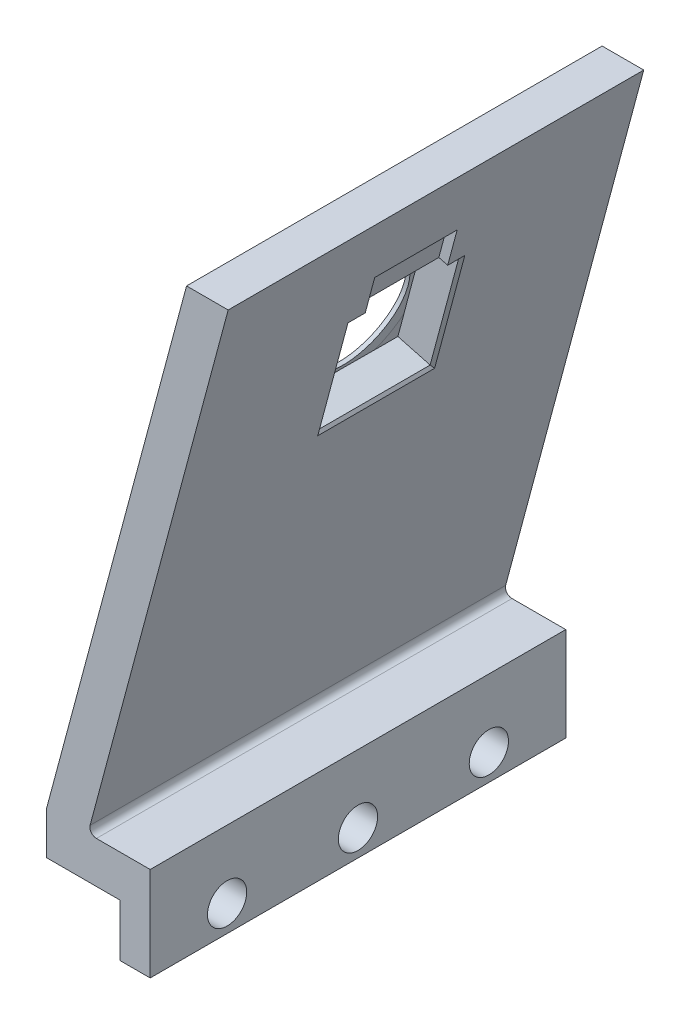
from build123d import *

# Parameters (mm, degrees)
ESQUISSE1_W             = 2.296627968
ESQUISSE1_H             = 4
BOSS_EXTRU_1_DEPTH      = 31.75
ESQUISSE2_W             = 8.53
ESQUISSE2_H             = 8.53
ENL_V_MAT_EXTRU_1_DEPTH = 2.75
ESQUISSE3_R             = 3.98
ENL_V_MAT_EXTRU_2_DEPTH = 31.75
CHANFREIN3_SIZE         = 0.01605866
CHANFREIN3_SIZE_2       = 0.92
ESQUISSE5_W             = 6.3
ESQUISSE5_H             = 3
ENL_V_MAT_EXTRU_3_DEPTH = 0.7
CHANFREIN4_SIZE         = 0.2
ESQUISSE6_R             = 1.5
ENL_V_MAT_EXTRU_4_DEPTH = 14.7
CONG_3_R                = 0.5


with BuildPart() as part:
    # Esquisse1 → Boss.-Extru.1 (new body)
    with BuildSketch(Plane.XY):
        Polygon((3.18, 0), (0, 0), (10.717967697, 40), (13.897967697, 40), align=None)
        Polygon((3.18, 0), (0, 0), (0, -3.18), (5.643372032, -3.18), (7.94, -3.18), (7.94, 0), align=None)
        with Locations((6.791686016, -5.18)):
            Rectangle(ESQUISSE1_W, ESQUISSE1_H)
    extrude(amount=BOSS_EXTRU_1_DEPTH)

    # Esquisse2 → Enlèv. mat.-Extru.1 (cut)
    with BuildSketch(Plane(origin=(2.966980392, -0.795, 0), x_dir=(0, 0, -1), z_dir=(0.9659258262890674, -0.2588190451025244, 0))):
        with Locations((-16.145, 30.088044563)):
            Rectangle(ESQUISSE2_W, ESQUISSE2_H)
    extrude(amount=-ENL_V_MAT_EXTRU_1_DEPTH, mode=Mode.SUBTRACT)

    # Esquisse3 → Enlèv. mat.-Extru.2 (cut)
    with BuildSketch(Plane(origin=(0.31068437, -0.083247626, 0), x_dir=(0, 0, -1), z_dir=(0.9659258262890674, -0.2588190451025245, 0))):
        with Locations(Location((-16.145, 30.055023218, 0), (0, 0, 90))):
            Circle(ESQUISSE3_R)
    extrude(amount=-ENL_V_MAT_EXTRU_2_DEPTH, mode=Mode.SUBTRACT)

    # Chanfrein3
    # the kernel refuses this chamfer: 0.92, 0.01605866 mm, written as the material it takes off along each edge
    with BuildSketch(Plane(origin=(8.08949678, 28.94767551, 16.145), x_dir=(0.2588190451025241, 0.9659258262890673, 0), z_dir=(0, 0, -1))) as chanfrein3_piece_1_section:
        Polygon((3.98, -CHANFREIN3_SIZE * 0.999999983433), (3.98 + CHANFREIN3_SIZE_2, 0), (3.98, 0), align=None)
    chanfrein3_piece_1 = revolve(axis=Axis((8.08949678, 28.94767551, 16.145), (0.9659258262890674, -0.2588190451025245, 0)), mode=Mode.PRIVATE)
    chanfrein3_piece_1 = split(chanfrein3_piece_1, bisect_by=Plane(origin=(9.196219069, 33.100769288, 19.703208658), z_dir=(-0.25881904510252435, -0.9659258262890673, 0)), keep=Keep.TOP, mode=Mode.PRIVATE)
    chanfrein3_piece_1 = split(chanfrein3_piece_1, bisect_by=Plane(origin=(8.615509723, 30.933532505, 20.41), z_dir=(0, 0, -1)), keep=Keep.TOP, mode=Mode.PRIVATE)
    chanfrein3_piece_1 = split(chanfrein3_piece_1, bisect_by=Plane(origin=(8.615509723, 30.933532505, 11.88), z_dir=(0, 0, 1)), keep=Keep.TOP, mode=Mode.PRIVATE)
    chanfrein3_piece_1 = split(chanfrein3_piece_1, bisect_by=Plane(origin=(6.988492614, 24.86142199, 19.703208658), z_dir=(0.25881904510252435, 0.9659258262890673, 0)), keep=Keep.TOP, mode=Mode.PRIVATE)
    add(chanfrein3_piece_1, mode=Mode.SUBTRACT)

    # Esquisse5 → Enlèv. mat.-Extru.3 (cut)
    with BuildSketch(Plane(origin=(2.966980392, -0.795, 0), x_dir=(0, 0, -1), z_dir=(0.9659258262890674, -0.2588190451025244, 0))):
        with Locations((-16.14, 35.853044563)):
            Rectangle(ESQUISSE5_W, ESQUISSE5_H)
    extrude(amount=-ENL_V_MAT_EXTRU_3_DEPTH, mode=Mode.SUBTRACT)

    # Chanfrein4
    chanfrein4_edges = [part.edges().sort_by_distance(p)[0] for p in [
        (10.754339355, 28.267819306, 20.41),
        (9.650476128, 24.148145657, 16.145),
        (10.754339355, 28.267819306, 11.88),
        (11.858202582, 32.387492955, 12.435),
        (11.858202582, 32.387492955, 19.85),
        (11.520128543, 32.478079621, 19.29),
        (11.182054504, 32.568666287, 16.14),
        (11.520128543, 32.478079621, 12.99),
    ]]
    chamfer(chanfrein4_edges, length=CHANFREIN4_SIZE)

    # Esquisse6 → Enlèv. mat.-Extru.4 (cut)
    with BuildSketch(Plane(origin=(7.94, 0, 0), x_dir=(0, 0, -1), z_dir=(1, 0, 0))):
        with Locations(Location((-25.875, -5.18, 0), (0, 0, 90))):
            Circle(ESQUISSE6_R)
        with Locations(Location((-15.875, -5.18, 0), (0, 0, 90))):
            Circle(ESQUISSE6_R)
        with Locations(Location((-5.875, -5.18, 0), (0, 0, 90))):
            Circle(ESQUISSE6_R)
    extrude(amount=-ENL_V_MAT_EXTRU_4_DEPTH, mode=Mode.SUBTRACT)

    # Congé3
    cong_3_edges = [part.edges().sort_by_distance(p)[0] for p in [
        (3.18, 0, 15.875),
    ]]
    fillet(cong_3_edges, radius=CONG_3_R)


solid = part.part
